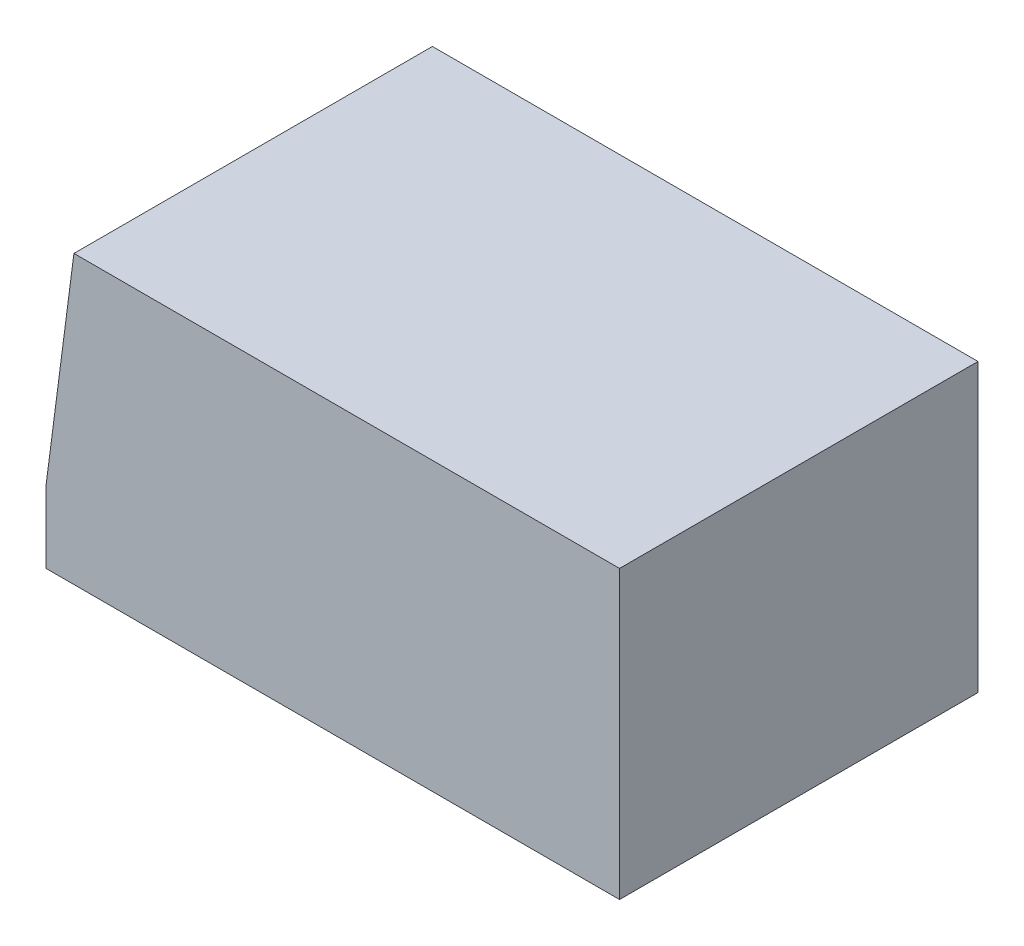
from build123d import *

# Parameters (mm, degrees)
ESQUISSE1_W             = 80
ESQUISSE1_H             = 50
BOSS_EXTRU_1_DEPTH      = 40
CHANFREIN1_SIZE         = 30
CHANFREIN1_SIZE2        = 3.896319712
ESQUISSE2_R             = 12.5
ENL_V_MAT_EXTRU_1_DEPTH = 40


with BuildPart() as part:
    # Esquisse1 → Boss.-Extru.1 (new body)
    with BuildSketch(Plane(origin=(0, 0, 0), x_dir=(1, 0, 0), z_dir=(0, 1, 0))):
        Rectangle(ESQUISSE1_W, ESQUISSE1_H)
    extrude(amount=BOSS_EXTRU_1_DEPTH)

    # Chanfrein1
    chanfrein1_edges = [part.edges().sort_by_distance(p)[0] for p in [
        (-40, 40, 0),
    ]]
    chanfrein1_side = [part.faces().sort_by_distance(p)[0] for p in [
        (-40, 20, 0),
    ]]
    chamfer(chanfrein1_edges, length=CHANFREIN1_SIZE, length2=CHANFREIN1_SIZE2, reference=chanfrein1_side[0])

    # Esquisse2 → Enlèv. mat.-Extru.1 (cut)
    with BuildSketch(Plane(origin=(-40.613696562, 5.274798216, 0), x_dir=(0, 0, 1), z_dir=(-0.9916711623830908, 0.12879559657755957, 0))):
        with Locations((0, 18.821046558)):
            Circle(ESQUISSE2_R)
    extrude(amount=-ENL_V_MAT_EXTRU_1_DEPTH, mode=Mode.SUBTRACT)


solid = part.part
